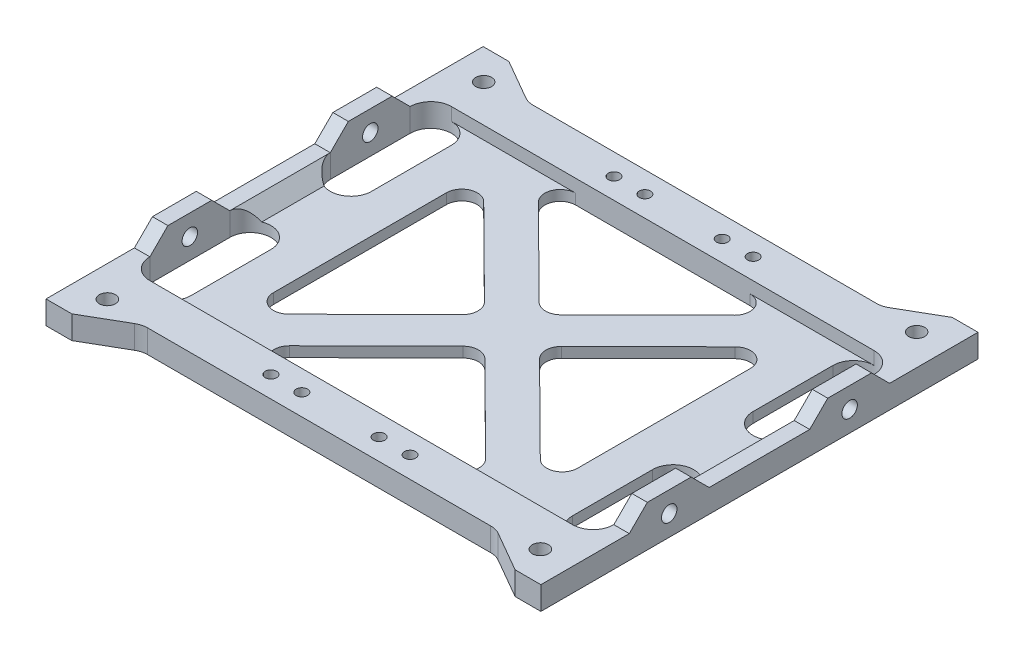
from build123d import *

# Parameters (mm, degrees)
SKETCH1_R           = 1.1
SKETCH1_R_2         = 1.55
BOSS_EXTRUDE1_DEPTH = 2
SKETCH2_R           = 1.55
SKETCH2_R_2         = 1.1
BOSS_EXTRUDE2_DEPTH = 2.5
BOSS_EXTRUDE3_START = -3
SKETCH3_W           = 15.5
SKETCH3_H           = 3.5
BOSS_EXTRUDE3_DEPTH = 3
SKETCH4_R           = 1.5
CUT_EXTRUDE1_DEPTH  = 5
CUT_EXTRUDE2_DEPTH  = 65.325422657
CUT_EXTRUDE3_DEPTH  = 106.250938238
CHAMFER1_SIZE       = 2.5


with BuildPart() as part:
    # Sketch1 → Boss-Extrude1 (new body)
    with BuildSketch(Plane(origin=(0, 0, 0), x_dir=(1, 0, 0), z_dir=(0, 1, 0))):
        with BuildLine():
            Line((-48, -42.4), (-43, -42.4))
            Line((-43, -42.4), (-35.267949192, -37.935898385))
            ThreePointArc((-35.267949192, -37.935898385), (-34.303225373, -37.536296695), (-33.267949192, -37.4))
            Line((-33.267949192, -37.4), (33.267949192, -37.4))
            ThreePointArc((33.267949192, -37.4), (34.303225373, -37.536296695), (35.267949192, -37.935898385))
            Line((35.267949192, -37.935898385), (43, -42.4))
            Line((43, -42.4), (48, -42.4))
            Line((48, -42.4), (48, 42.4))
            Line((48, 42.4), (43, 42.4))
            Line((43, 42.4), (35.267949192, 37.935898385))
            ThreePointArc((35.267949192, 37.935898385), (34.303225373, 37.536296695), (33.267949192, 37.4))
            Line((33.267949192, 37.4), (-33.267949192, 37.4))
            ThreePointArc((-33.267949192, 37.4), (-34.303225373, 37.536296695), (-35.267949192, 37.935898385))
            Line((-35.267949192, 37.935898385), (-43, 42.4))
            Line((-43, 42.4), (-48, 42.4))
            Line((-48, 42.4), (-48, -42.4))
        make_face()
        with Locations(Location((-13.5, -33.275, 0), (0, 0, 270))):
            Circle(SKETCH1_R, mode=Mode.SUBTRACT)
        with Locations(Location((-7.5, -33.275, 0), (0, 0, 270))):
            Circle(SKETCH1_R, mode=Mode.SUBTRACT)
        with Locations(Location((7.5, -33.275, 0), (0, 0, 270))):
            Circle(SKETCH1_R, mode=Mode.SUBTRACT)
        with Locations(Location((13.5, -33.275, 0), (0, 0, 270))):
            Circle(SKETCH1_R, mode=Mode.SUBTRACT)
        with Locations(Location((-13.5, 33.275, 0), (0, 0, 270))):
            Circle(SKETCH1_R, mode=Mode.SUBTRACT)
        with Locations(Location((-7.5, 33.275, 0), (0, 0, 270))):
            Circle(SKETCH1_R, mode=Mode.SUBTRACT)
        with Locations(Location((7.5, 33.275, 0), (0, 0, 270))):
            Circle(SKETCH1_R, mode=Mode.SUBTRACT)
        with Locations(Location((13.5, 33.275, 0), (0, 0, 270))):
            Circle(SKETCH1_R, mode=Mode.SUBTRACT)
        with Locations(Location((-42, 36.5, 0), (0, 0, 270))):
            Circle(SKETCH1_R_2, mode=Mode.SUBTRACT)
        with Locations(Location((42, 36.5, 0), (0, 0, 270))):
            Circle(SKETCH1_R_2, mode=Mode.SUBTRACT)
        with Locations(Location((42, -36.5, 0), (0, 0, 270))):
            Circle(SKETCH1_R_2, mode=Mode.SUBTRACT)
        with Locations(Location((-42, -36.5, 0), (0, 0, 270))):
            Circle(SKETCH1_R_2, mode=Mode.SUBTRACT)
        with BuildLine():
            Line((-37, 25.25), (-37, 9.75))
            ThreePointArc((-37, 9.75), (-41, 5.75), (-45, 9.75))
            Line((-45, 9.75), (-45, 25.25))
            ThreePointArc((-45, 25.25), (-41, 29.25), (-37, 25.25))
        make_face(mode=Mode.SUBTRACT)
        with BuildLine():
            Line((-37, -9.75), (-37, -25.25))
            ThreePointArc((-37, -25.25), (-41, -29.25), (-45, -25.25))
            Line((-45, -25.25), (-45, -9.75))
            ThreePointArc((-45, -9.75), (-41, -5.75), (-37, -9.75))
        make_face(mode=Mode.SUBTRACT)
        with BuildLine():
            Line((45, 25.25), (45, 9.75))
            ThreePointArc((45, 9.75), (41, 5.75), (37, 9.75))
            Line((37, 9.75), (37, 25.25))
            ThreePointArc((37, 25.25), (41, 29.25), (45, 25.25))
        make_face(mode=Mode.SUBTRACT)
        with BuildLine():
            Line((45, -9.75), (45, -25.25))
            ThreePointArc((45, -25.25), (41, -29.25), (37, -25.25))
            Line((37, -25.25), (37, -9.75))
            ThreePointArc((37, -9.75), (41, -5.75), (45, -9.75))
        make_face(mode=Mode.SUBTRACT)
    extrude(amount=BOSS_EXTRUDE1_DEPTH)

    # Sketch2 → Boss-Extrude2 (add)
    with BuildSketch(Plane(origin=(0, 2, 0), x_dir=(1, 0, 0), z_dir=(0, 1, 0))):
        with BuildLine():
            Line((48, -42.4), (48, 42.4))
            Line((48, 42.4), (43, 42.4))
            Line((43, 42.4), (35.267949192, 37.935898385))
            ThreePointArc((35.267949192, 37.935898385), (34.303225373, 37.536296695), (33.267949192, 37.4))
            Line((33.267949192, 37.4), (-33.267949192, 37.4))
            ThreePointArc((-33.267949192, 37.4), (-34.303225373, 37.536296695), (-35.267949192, 37.935898385))
            Line((-35.267949192, 37.935898385), (-43, 42.4))
            Line((-43, 42.4), (-48, 42.4))
            Line((-48, 42.4), (-48, -42.4))
            Line((-48, -42.4), (-43, -42.4))
            Line((-43, -42.4), (-35.267949192, -37.935898385))
            ThreePointArc((-35.267949192, -37.935898385), (-34.303225373, -37.536296695), (-33.267949192, -37.4))
            Line((-33.267949192, -37.4), (33.267949192, -37.4))
            ThreePointArc((33.267949192, -37.4), (34.303225373, -37.536296695), (35.267949192, -37.935898385))
            Line((35.267949192, -37.935898385), (43, -42.4))
            Line((43, -42.4), (48, -42.4))
        make_face()
        with Locations((-42, -36.5)):
            Circle(SKETCH2_R, mode=Mode.SUBTRACT)
        with Locations((-13.5, -33.275)):
            Circle(SKETCH2_R_2, mode=Mode.SUBTRACT)
        with Locations((-7.5, -33.275)):
            Circle(SKETCH2_R_2, mode=Mode.SUBTRACT)
        with Locations((7.5, -33.275)):
            Circle(SKETCH2_R_2, mode=Mode.SUBTRACT)
        with Locations((13.5, -33.275)):
            Circle(SKETCH2_R_2, mode=Mode.SUBTRACT)
        with Locations((42, -36.5)):
            Circle(SKETCH2_R, mode=Mode.SUBTRACT)
        with Locations((-42, 36.5)):
            Circle(SKETCH2_R, mode=Mode.SUBTRACT)
        with Locations((-13.5, 33.275)):
            Circle(SKETCH2_R_2, mode=Mode.SUBTRACT)
        with Locations((-7.5, 33.275)):
            Circle(SKETCH2_R_2, mode=Mode.SUBTRACT)
        with BuildLine():
            Line((45, 9.75), (45, -9.75))
            Line((45, -9.75), (45, -25.25))
            ThreePointArc((45, -25.25), (43.828427125, -28.078427125), (41, -29.25))
            Line((41, -29.25), (-41, -29.25))
            ThreePointArc((-41, -29.25), (-43.828427125, -28.078427125), (-45, -25.25))
            Line((-45, -25.25), (-45, -9.75))
            Line((-45, -9.75), (-45, 9.75))
            Line((-45, 9.75), (-45, 25.25))
            ThreePointArc((-45, 25.25), (-43.828427125, 28.078427125), (-41, 29.25))
            Line((-41, 29.25), (41, 29.25))
            ThreePointArc((41, 29.25), (43.828427125, 28.078427125), (45, 25.25))
            Line((45, 25.25), (45, 9.75))
        make_face(mode=Mode.SUBTRACT)
        with Locations((7.5, 33.275)):
            Circle(SKETCH2_R_2, mode=Mode.SUBTRACT)
        with Locations((13.5, 33.275)):
            Circle(SKETCH2_R_2, mode=Mode.SUBTRACT)
        with Locations((42, 36.5)):
            Circle(SKETCH2_R, mode=Mode.SUBTRACT)
    extrude(amount=BOSS_EXTRUDE2_DEPTH)

    # Sketch3 → Boss-Extrude3 (add)
    with BuildSketch(Plane(origin=(48, 0, 0), x_dir=(0, 0, -1), z_dir=(1, 0, 0)).offset(BOSS_EXTRUDE3_START)):
        with Locations((-17.5, 6.25)):
            Rectangle(SKETCH3_W, SKETCH3_H)
        with Locations((17.5, 6.25)):
            Rectangle(SKETCH3_W, SKETCH3_H)
    boss_extrude3 = extrude(amount=BOSS_EXTRUDE3_DEPTH)

    # Sketch4 → Cut-Extrude1 (cut)
    with BuildSketch(Plane(origin=(48, 0, 0), x_dir=(0, 0, -1), z_dir=(1, 0, 0))):
        with Locations((-17.5, 4)):
            Circle(SKETCH4_R)
        with Locations((17.5, 4)):
            Circle(SKETCH4_R)
    cut_extrude1 = extrude(amount=-CUT_EXTRUDE1_DEPTH, mode=Mode.SUBTRACT)

    # Mirror1: Boss-Extrude3, Cut-Extrude1 across plane
    add(boss_extrude3.mirror(Plane(origin=(0, 0, 0), x_dir=(0, 0, 1), z_dir=(1, 0, 0))))
    add(cut_extrude1.mirror(Plane(origin=(0, 0, 0), x_dir=(0, 0, 1), z_dir=(1, 0, 0))), mode=Mode.SUBTRACT)

    # Sketch5 → Cut-Extrude2 (cut, through all)
    with BuildSketch(Plane(origin=(0, 2, 0), x_dir=(1, 0, 0), z_dir=(0, 1, 0))):
        with BuildLine():
            Line((-24.387725676, -18.900172978), (-7.47454864, -2.130327951))
            ThreePointArc((-7.47454864, -2.130327951), (-6.586822965, 0), (-7.47454864, 2.130327951))
            Line((-7.47454864, 2.130327951), (-24.387725676, 18.900172978))
            ThreePointArc((-24.387725676, 18.900172978), (-27.653944762, 19.539034707), (-29.5, 16.769845027))
            Line((-29.5, 16.769845027), (-29.5, -16.769845027))
            ThreePointArc((-29.5, -16.769845027), (-27.653944762, -19.539034707), (-24.387725676, -18.900172978))
        make_face()
        with BuildLine():
            Line((18.999810334, 24.119672049), (2.112274324, 7.375250751))
            ThreePointArc((2.112274324, 7.375250751), (0, 6.505578702), (-2.112274324, 7.375250751))
            Line((-2.112274324, 7.375250751), (-18.999810334, 24.119672049))
            ThreePointArc((-18.999810334, 24.119672049), (-19.661610977, 27.392150635), (-16.88753601, 29.25))
            Line((-16.88753601, 29.25), (16.88753601, 29.25))
            ThreePointArc((16.88753601, 29.25), (19.661610977, 27.392150635), (18.999810334, 24.119672049))
        make_face()
        with BuildLine():
            Line((-18.999810334, -24.119672049), (-2.112274324, -7.375250751))
            ThreePointArc((-2.112274324, -7.375250751), (0, -6.505578702), (2.112274324, -7.375250751))
            Line((2.112274324, -7.375250751), (18.999810334, -24.119672049))
            ThreePointArc((18.999810334, -24.119672049), (19.661610977, -27.392150635), (16.88753601, -29.25))
            Line((16.88753601, -29.25), (-16.88753601, -29.25))
            ThreePointArc((-16.88753601, -29.25), (-19.661610977, -27.392150635), (-18.999810334, -24.119672049))
        make_face()
        with BuildLine():
            Line((7.47454864, 2.130327951), (24.387725676, 18.900172978))
            ThreePointArc((24.387725676, 18.900172978), (27.653944762, 19.539034707), (29.5, 16.769845027))
            Line((29.5, 16.769845027), (29.5, -16.769845027))
            ThreePointArc((29.5, -16.769845027), (27.653944762, -19.539034707), (24.387725676, -18.900172978))
            Line((24.387725676, -18.900172978), (7.47454864, -2.130327951))
            ThreePointArc((7.47454864, -2.130327951), (6.586822965, 0), (7.47454864, 2.130327951))
        make_face()
    extrude(amount=-CUT_EXTRUDE2_DEPTH, mode=Mode.SUBTRACT)

    # Sketch6 → Cut-Extrude3 (cut, through all)
    with BuildSketch(Plane.ZY.offset(48)):
        Polygon((-25.25, 4.5), (-21.75, 8), (-25.25, 8), align=None)
        Polygon((-9.75, 4.5), (-13.25, 8), (-9.75, 8), align=None)
        Polygon((9.75, 4.5), (9.75, 8), (13.25, 8), align=None)
        Polygon((25.25, 4.5), (25.25, 8), (21.75, 8), align=None)
    extrude(amount=-CUT_EXTRUDE3_DEPTH, mode=Mode.SUBTRACT)

    # Chamfer1
    chamfer1_edges = [part.edges().sort_by_distance(p)[0] for p in [
        (45, 2, 0),
        (-45, 2, 0),
    ]]
    chamfer(chamfer1_edges, length=CHAMFER1_SIZE - 0.0001)  # a hair under: the kernel refuses the full size


solid = part.part
